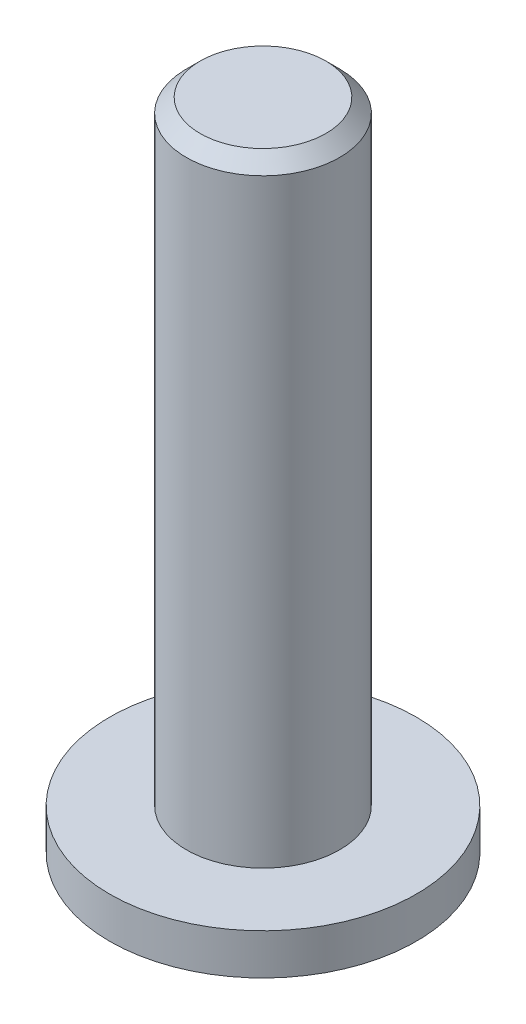
from build123d import *

# Parameters (mm, degrees)
SKETCH_1_R          = 3
EXTRUDE_1_DEPTH     = 0.8
CUT_EXTRUDE_1_DEPTH = 0.5


# Read off the part's stored shape, not the designer's step: M3 机械螺纹 螺柱3
with BuildPart() as part:
    # 草图1 → 凸台-拉伸1 (new body)
    with BuildSketch(Plane(origin=(0, 0, 0), x_dir=(1, 0, 0), z_dir=(0, 1, 0))):
        with Locations(Location((0, 0, 0), (0, 0, 270))):
            Circle(SKETCH_1_R)
    extrude(amount=EXTRUDE_1_DEPTH)

    # M3 机械螺纹 螺柱3 outline → M3 机械螺纹 螺柱3 (revolve)
    with BuildSketch(Plane.XY):
        Polygon((1.2295, 12.8), (0, 12.8), (0, 0.8), (1.5, 0.8), (1.5, 12.5295), align=None)
    revolve(axis=Axis((0, 0, 0), (0, 1, 0)))

    # 草图8 → 切除-拉伸1 (cut)
    with BuildSketch(Plane.XZ):
        Polygon((1.154700538, 0), (0.577350269, 1), (-0.577350269, 1), (-1.154700538, 0), (-0.577350269, -1), (0.577350269, -1), align=None)
    extrude(amount=-CUT_EXTRUDE_1_DEPTH, mode=Mode.SUBTRACT)


solid = part.part
